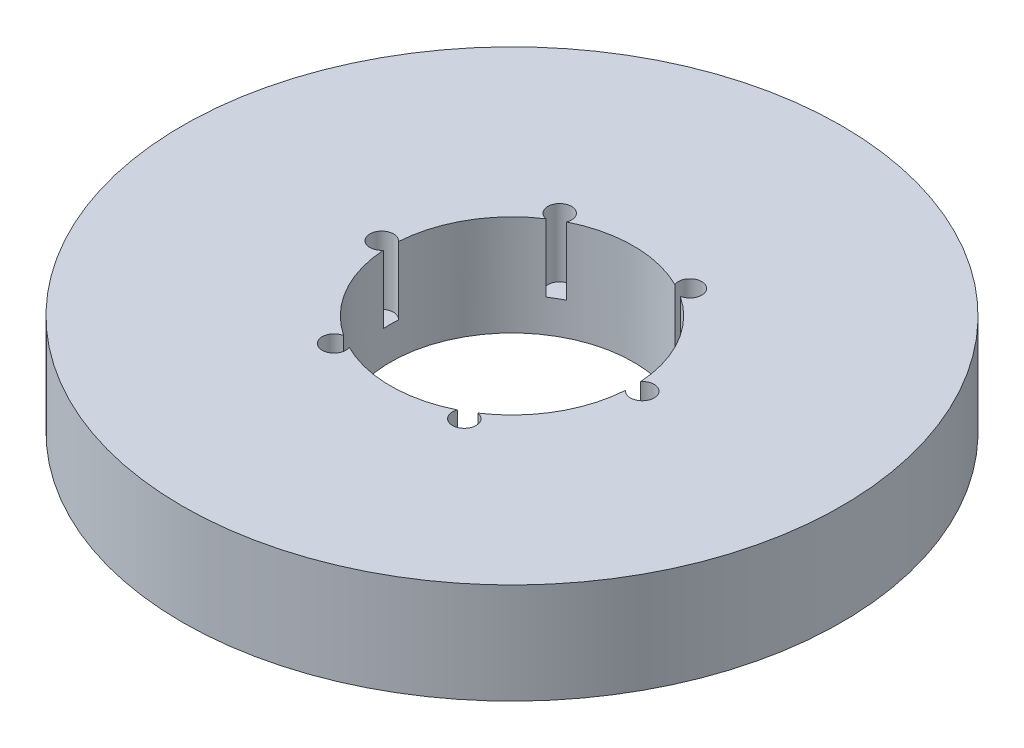
from build123d import *

# Parameters (mm, degrees)
SKETCH1_R           = 95
BOSS_EXTRUDE1_DEPTH = 29
SKETCH2_R           = 35
CUT_EXTRUDE1_DEPTH  = 138.444534267
SKETCH3_R           = 3.405456173
CUT_EXTRUDE2_DEPTH  = 19.556295195
CIRPATTERN1_COUNT   = 6


with BuildPart() as part:
    # Sketch1 → Boss-Extrude1 (new body)
    with BuildSketch(Plane(origin=(0, 0, 0), x_dir=(1, 0, 0), z_dir=(0, 1, 0))):
        Circle(SKETCH1_R)
    extrude(amount=BOSS_EXTRUDE1_DEPTH)

    # Sketch2 → Cut-Extrude1 (cut, through all)
    with BuildSketch(Plane(origin=(0, 0, 0), x_dir=(1, 0, 0), z_dir=(0, 1, 0))):
        Circle(SKETCH2_R)
    extrude(amount=CUT_EXTRUDE1_DEPTH, mode=Mode.SUBTRACT)

    # Sketch3 → Cut-Extrude2 (cut)
    with BuildSketch(Plane(origin=(0, 29, 0), x_dir=(1, 0, 0), z_dir=(0, 1, 0))):
        with Locations((-37.557373164, 0)):
            Circle(SKETCH3_R)
    cut_extrude2 = extrude(amount=-CUT_EXTRUDE2_DEPTH, mode=Mode.SUBTRACT)

    # CirPattern1: Cut-Extrude2 ×6 about axis
    cirpattern1_axis = Axis((0, 0, 0), (0, 1, 0))
    for i in range(1, CIRPATTERN1_COUNT):
        add(cut_extrude2.rotate(cirpattern1_axis, i * 360 / CIRPATTERN1_COUNT), mode=Mode.SUBTRACT)


solid = part.part
